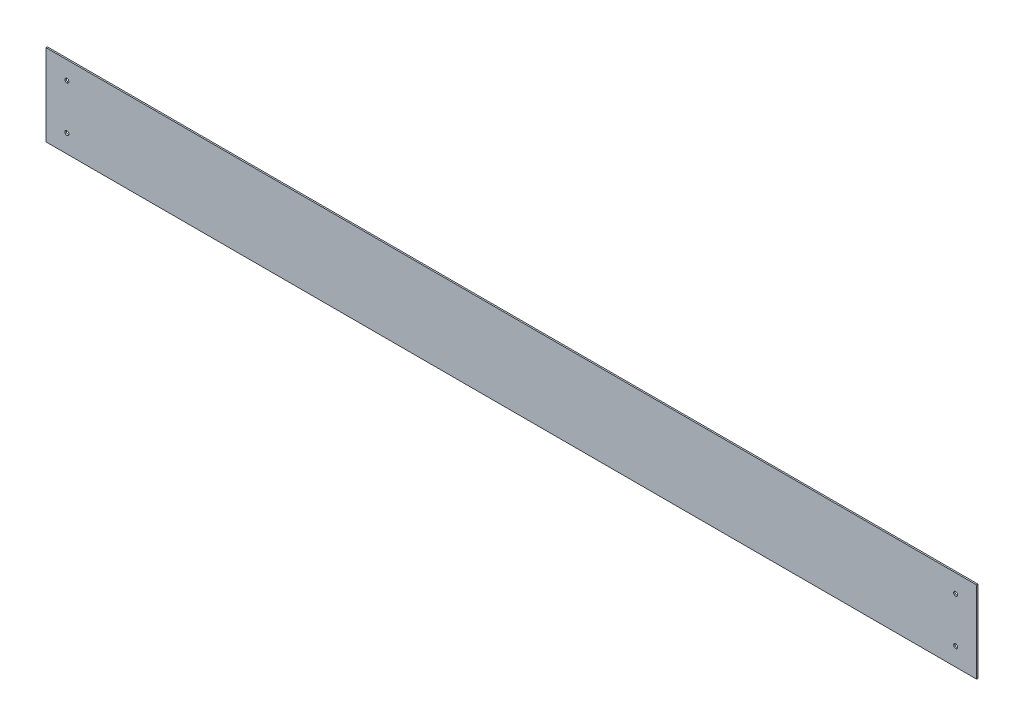
from build123d import *

# Parameters (mm, degrees)
SKETCH1_W            = 1026
SKETCH1_H            = 90
BOSS_EXTRUDE1_DEPTH  = 1.5875
M4_CLEARANCE_HOLE1_D = 4.5


with BuildPart() as part:
    # Sketch1 → Boss-Extrude1 (new body)
    with BuildSketch(Plane.XY):
        Rectangle(SKETCH1_W, SKETCH1_H)
    extrude(amount=BOSS_EXTRUDE1_DEPTH)

    # M4 Clearance Hole1 (through all)
    with Locations(Plane.XY.offset(1.5875)):
        with Locations((-490, 25), (-490, -25), (490, -25), (490, 25)):
            Hole(M4_CLEARANCE_HOLE1_D / 2)


solid = part.part
